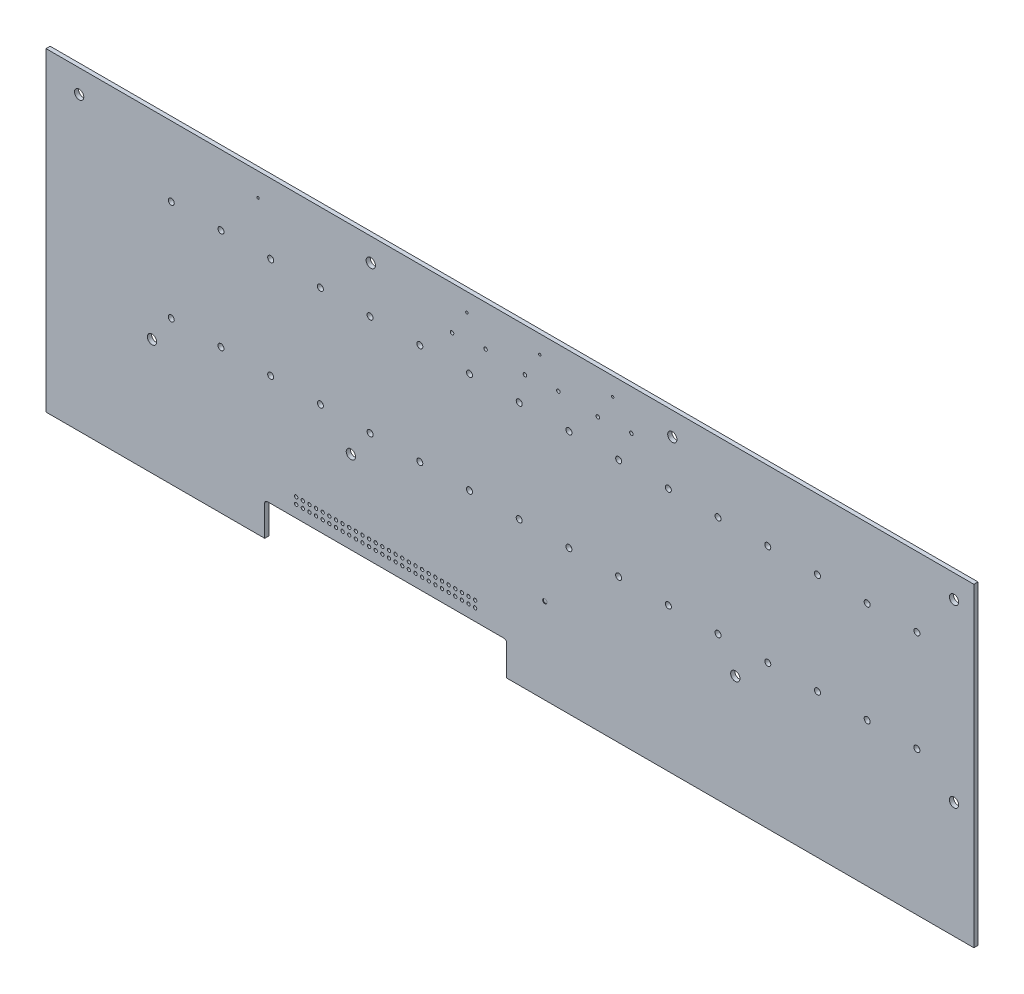
from build123d import *

# Parameters (mm, degrees)
SKETCH1_W                    = 355.6
SKETCH1_H                    = 120.65
EXTRUDE1_DEPTH               = 1.5748
DSPBOARD_CONNECTOR_HOLES_R   = 1.15
CUT_EXTRUDE1_DEPTH           = 2.54
LPATTERN1_COUNT              = 16
LPATTERN1_PITCH              = 19.05
SKETCH2_R                    = 1.778
PCB_MOUNT_HOLES_DEPTH        = 2.54
SKETCH6_R                    = 0.675005
PERIPHERAL_SATA_DEPTH        = 2.54
SKETCH7_R                    = 0.4499991
SKETCH7_R_2                  = 0.449961
OFF_BOARD_HEADER_HOLES_DEPTH = 2.54
NIC_CUTOUT_DEPTH             = 2.54
SKETCH10_R                   = 0.635
HEADER_HOLES_DEPTH           = 2.54
BGA_MOUNT_POS_R              = 0.838088067
CUT_EXTRUDE11_DEPTH          = 0.254
LPATTERN3_COUNT              = 28
LPATTERN3_PITCH              = 2.54
LPATTERN3_COUNT_DIR2         = 2
LPATTERN3_PITCH_DIR2         = 2.54
LPATTERN4_COUNT              = 3
LPATTERN4_PITCH              = 27.94


with BuildPart() as part:
    # Sketch1 → Extrude1 (new body)
    with BuildSketch(Plane.XY):
        with Locations((177.8, -60.325)):
            Rectangle(SKETCH1_W, SKETCH1_H)
    extrude(amount=EXTRUDE1_DEPTH)

    # DSPboard connector holes → Cut-Extrude1 (cut)
    with BuildSketch(Plane.XY.offset(1.5748)):
        with Locations((48.006, -65.532)):
            Circle(DSPBOARD_CONNECTOR_HOLES_R)
        with Locations((48.006, -26.802)):
            Circle(DSPBOARD_CONNECTOR_HOLES_R)
    cut_extrude1 = extrude(amount=-CUT_EXTRUDE1_DEPTH, mode=Mode.SUBTRACT)

    # LPattern1: Cut-Extrude1 ×16
    with Locations(*[(i * LPATTERN1_PITCH, 0, 0) for i in range(1, LPATTERN1_COUNT)]):
        add(cut_extrude1, mode=Mode.SUBTRACT)

    # Sketch2 → PCB Mount holes (cut)
    with BuildSketch(Plane.XY.offset(1.5748)):
        with Locations((12.7, -8.89)):
            Circle(SKETCH2_R)
        with Locations((124.46, -8.89)):
            Circle(SKETCH2_R)
        with Locations((240.03, -8.89)):
            Circle(SKETCH2_R)
        with Locations((347.98, -8.89)):
            Circle(SKETCH2_R)
        with Locations((40.64, -76.2)):
            Circle(SKETCH2_R)
        with Locations((116.84, -76.2)):
            Circle(SKETCH2_R)
        with Locations((264.16, -76.2)):
            Circle(SKETCH2_R)
        with Locations((347.98, -76.2)):
            Circle(SKETCH2_R)
    extrude(amount=-PCB_MOUNT_HOLES_DEPTH, mode=Mode.SUBTRACT)

    # Sketch6 → Peripheral-SATA (cut)
    with BuildSketch(Plane.XY.offset(1.5748)):
        with Locations((168.4383248, -15.51)):
            Circle(SKETCH6_R)
        with Locations((155.6083248, -16.51)):
            Circle(SKETCH6_R)
    peripheral_sata = extrude(amount=-PERIPHERAL_SATA_DEPTH, mode=Mode.SUBTRACT)

    # Sketch7 → Off-board header holes (cut)
    with BuildSketch(Plane.XY.offset(1.5748)):
        with Locations((217.17, -6.985)):
            Circle(SKETCH7_R)
        with Locations((189.23, -6.985)):
            Circle(SKETCH7_R_2)
        with Locations((161.29, -6.985)):
            Circle(SKETCH7_R_2)
        with Locations((81.28, -8.89)):
            Circle(SKETCH7_R_2)
    extrude(amount=-OFF_BOARD_HEADER_HOLES_DEPTH, mode=Mode.SUBTRACT)

    # Sketch9 → NIC cutout (cut)
    with BuildSketch(Plane.XY.offset(1.5748)):
        with BuildLine():
            Line((84.836, -107.95), (175.514, -107.95))
            ThreePointArc((175.514, -107.95), (176.23242049, -108.24757951), (176.53, -108.966))
            Line((176.53, -108.966), (176.53, -120.65))
            Line((176.53, -120.65), (83.82, -120.65))
            Line((83.82, -120.65), (83.82, -108.966))
            ThreePointArc((83.82, -108.966), (84.11757951, -108.24757951), (84.836, -107.95))
        make_face()
    extrude(amount=-NIC_CUTOUT_DEPTH, mode=Mode.SUBTRACT)

    # Sketch10 → Header Holes (cut)
    with BuildSketch(Plane.XY.offset(1.5748)):
        with Locations((164.465, -100.838)):
            Circle(SKETCH10_R)
    header_holes = extrude(amount=-HEADER_HOLES_DEPTH, mode=Mode.SUBTRACT)

    # BGA mount pos → Cut-Extrude11 (cut)
    with BuildSketch(Plane.XY.offset(1.5748)):
        with Locations((191.2, -87.85)):
            Circle(BGA_MOUNT_POS_R)
    extrude(amount=-CUT_EXTRUDE11_DEPTH, mode=Mode.SUBTRACT)

    # LPattern3: Header Holes 28 × 2
    with Locations(*[(-i * LPATTERN3_PITCH, -j * LPATTERN3_PITCH_DIR2, 0) for i in range(LPATTERN3_COUNT) for j in range(LPATTERN3_COUNT_DIR2) if (i, j) != (0, 0)]):
        add(header_holes, mode=Mode.SUBTRACT)

    # LPattern4: Peripheral-SATA ×3
    with Locations(*[(i * LPATTERN4_PITCH, 0, 0) for i in range(1, LPATTERN4_COUNT)]):
        add(peripheral_sata, mode=Mode.SUBTRACT)


solid = part.part
